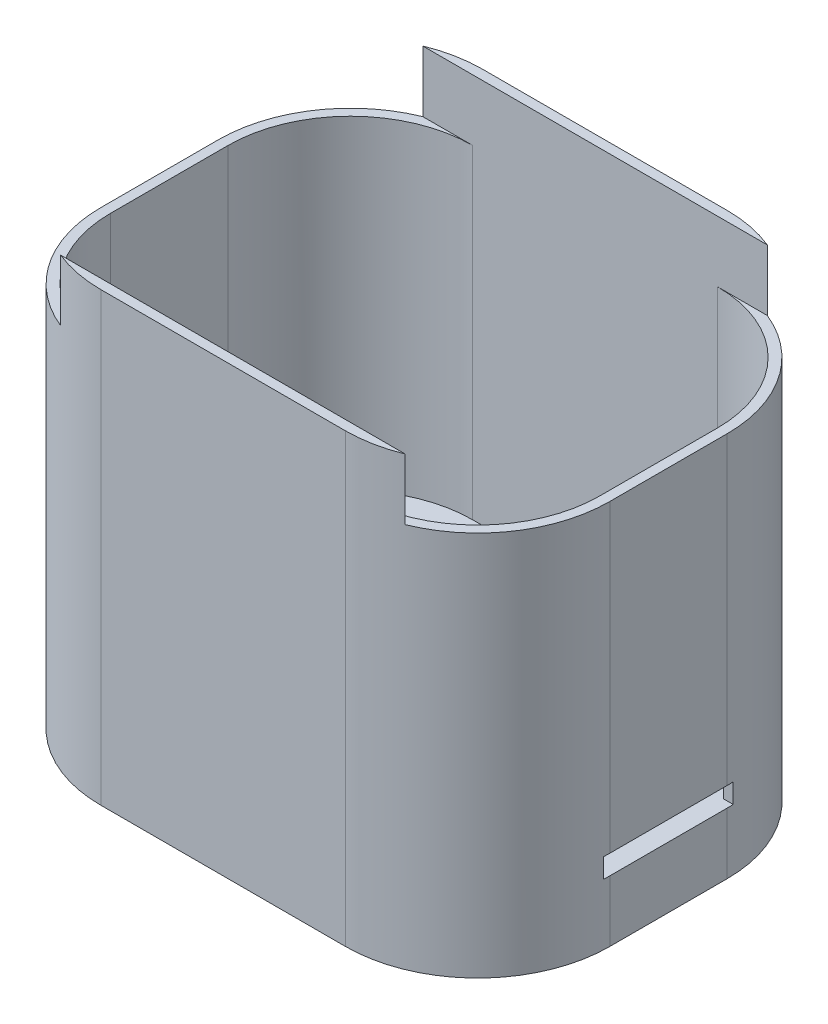
from build123d import *

# Parameters (mm, degrees)
EXTRUDE_1_DEPTH     = 36.5
SKETCH_4_W          = 41.6
SKETCH_4_H          = 29.6
CUT_EXTRUDE_1_DEPTH = 5
EXTRUDE_2_DEPTH     = 5
SKETCH_6_W          = 10.6
SKETCH_6_H          = 1.6
CUT_EXTRUDE_2_DEPTH = 58.499304344
SKETCH_7_R          = 1.3
CUT_EXTRUDE_3_DEPTH = 45.81350243


with BuildPart() as part:
    # 草圖1 → 填料-伸長1 (new body)
    with BuildSketch(Plane(origin=(0, 0, 0), x_dir=(1, 0, 0), z_dir=(0, 1, 0))):
        with BuildLine():
            Line((-10, -15.6), (10, -15.6))
            ThreePointArc((10, -15.6), (17.636753237, -12.436753237), (20.8, -4.8))
            Line((20.8, -4.8), (20.8, 4.8))
            ThreePointArc((20.8, 4.8), (17.636753237, 12.436753237), (10, 15.6))
            Line((10, 15.6), (-10, 15.6))
            ThreePointArc((-10, 15.6), (-17.636753237, 12.436753237), (-20.8, 4.8))
            Line((-20.8, 4.8), (-20.8, -4.8))
            ThreePointArc((-20.8, -4.8), (-17.636753237, -12.436753237), (-10, -15.6))
        make_face()
        with BuildLine():
            Line((-10, -14.8), (10, -14.8))
            ThreePointArc((10, -14.8), (17.071067812, -11.871067812), (20, -4.8))
            Line((20, -4.8), (20, 4.8))
            ThreePointArc((20, 4.8), (17.071067812, 11.871067812), (10, 14.8))
            Line((10, 14.8), (-10, 14.8))
            ThreePointArc((-10, 14.8), (-17.071067812, 11.871067812), (-20, 4.8))
            Line((-20, 4.8), (-20, -4.8))
            ThreePointArc((-20, -4.8), (-17.071067812, -11.871067812), (-10, -14.8))
        make_face(mode=Mode.SUBTRACT)
    extrude(amount=EXTRUDE_1_DEPTH)

    # 草圖4 → 除料-伸長1 (cut)
    with BuildSketch(Plane(origin=(0, 36.5, 0), x_dir=(1, 0, 0), z_dir=(0, 1, 0))):
        Rectangle(SKETCH_4_W, SKETCH_4_H)
    extrude(amount=-CUT_EXTRUDE_1_DEPTH, mode=Mode.SUBTRACT)

    # 草圖5 → 填料-伸長2 (add)
    with BuildSketch(Plane.XZ):
        with BuildLine():
            Line((20, 4.8), (20, -4.8))
            ThreePointArc((20, -4.8), (17.071067812, -11.871067812), (10, -14.8))
            Line((10, -14.8), (-10, -14.8))
            ThreePointArc((-10, -14.8), (-17.071067812, -11.871067812), (-20, -4.8))
            Line((-20, -4.8), (-20, 4.8))
            ThreePointArc((-20, 4.8), (-17.071067812, 11.871067812), (-10, 14.8))
            Line((-10, 14.8), (10, 14.8))
            ThreePointArc((10, 14.8), (17.071067812, 11.871067812), (20, 4.8))
        make_face()
    extrude(amount=-EXTRUDE_2_DEPTH)

    # 草圖6 → 除料-伸長2 (cut, through all)
    with BuildSketch(Plane(origin=(20.8, 0, 0), x_dir=(0, 0, -1), z_dir=(1, 0, 0))):
        with Locations((0, 5.8)):
            Rectangle(SKETCH_6_W, SKETCH_6_H)
    extrude(amount=-CUT_EXTRUDE_2_DEPTH, mode=Mode.SUBTRACT)

    # 草圖7 → 除料-伸長3 (cut, through all)
    with BuildSketch(Plane.XZ):
        with Locations((-12, 3.8)):
            Circle(SKETCH_7_R)
        with Locations((-4, 3.8)):
            Circle(SKETCH_7_R)
        with Locations((4, 3.8)):
            Circle(SKETCH_7_R)
        with Locations((12, 3.8)):
            Circle(SKETCH_7_R)
        with Locations((12, -3.8)):
            Circle(SKETCH_7_R)
        with Locations((4, -3.8)):
            Circle(SKETCH_7_R)
        with Locations((-4, -3.8)):
            Circle(SKETCH_7_R)
        with Locations((-12, -3.8)):
            Circle(SKETCH_7_R)
    extrude(amount=-CUT_EXTRUDE_3_DEPTH, mode=Mode.SUBTRACT)


solid = part.part
